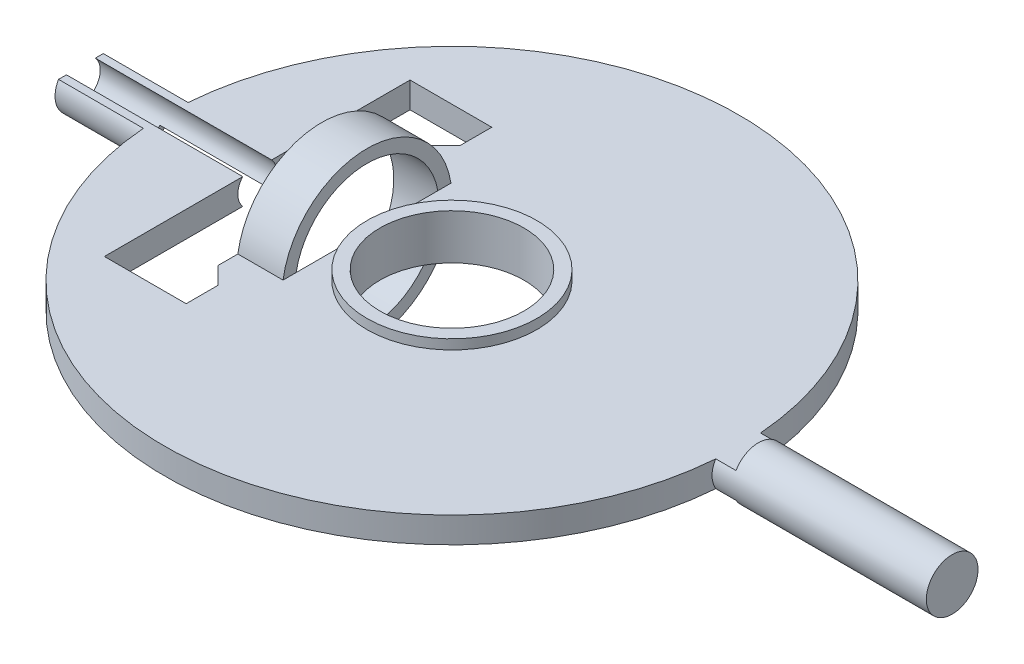
from build123d import *

# Parameters (mm, degrees)
SKETCH1_R                    = 44.45
BOSS_EXTRUDE1_DEPTH          = 2
SKETCH5_R                    = 13.15
SKETCH5_R_2                  = 11.15
BOSS_EXTRUDE2_DEPTH          = 3.5
CUT_EXTRUDE2_DEPTH           = 63.959153425
CUT_EXTRUDE2_DEPTH_BACK      = 63.959153425
SKETCH5_2_R                  = 11.15
BOSS_EXTRUDE4_DEPTH          = 2
CUT_EXTRUDE_THIN1_REACH      = 106.853
CUT_EXTRUDE_THIN1_END_RADIUS = 44.45
SKETCH7_R                    = 8
SKETCH7_R_2                  = 4
BOSS_EXTRUDE6_START          = 30
SKETCH7_3_R                  = 4
BOSS_EXTRUDE6_DEPTH          = 30
BOSS_EXTRUDE7_START          = 30
SKETCH11_R                   = 4
BOSS_EXTRUDE7_DEPTH          = 30
CUT_EXTRUDE3_REACH           = 163.201
CUT_EXTRUDE3_END_RADIUS      = 13.15
SKETCH13_R                   = 3
SKETCH15_R                   = 13.15
SKETCH15_R_2                 = 11.15
BOSS_EXTRUDE8_DEPTH          = 7
SKETCH15_2_R                 = 11.15
CUT_EXTRUDE4_DEPTH           = 17
CUT_EXTRUDE8_DEPTH           = 91.261993798
CUT_EXTRUDE8_DEPTH_BACK      = 91.261993798
CUT_EXTRUDE9_DEPTH           = 134.224378433
CUT_EXTRUDE10_DEPTH          = 20


with BuildPart() as part:
    # Sketch1 → Boss-Extrude1 (new, symmetric)
    with BuildSketch(Plane(origin=(0, 0, 0), x_dir=(1, 0, 0), z_dir=(0, 1, 0))):
        Circle(SKETCH1_R)
    extrude(amount=BOSS_EXTRUDE1_DEPTH, both=True)

    # Sketch5 → Boss-Extrude2 (add, symmetric)
    with BuildSketch(Plane(origin=(0, 0, 0), x_dir=(1, 0, 0), z_dir=(0, 1, 0))):
        Circle(SKETCH5_R)
        Circle(SKETCH5_R_2, mode=Mode.SUBTRACT)
    extrude(amount=BOSS_EXTRUDE2_DEPTH, both=True)

    # Sketch5<2> → Cut-Extrude2 (cut, two sides: drawn at the far end of the back side and taken through both)
    with BuildSketch(Plane(origin=(0, 0, 0), x_dir=(1, 0, 0), z_dir=(0, 1, 0)).offset(-CUT_EXTRUDE2_DEPTH_BACK)):
        Circle(SKETCH5_2_R)
    extrude(amount=CUT_EXTRUDE2_DEPTH + CUT_EXTRUDE2_DEPTH_BACK, mode=Mode.SUBTRACT)

    # Sketch6 → Boss-Extrude4 (add, symmetric)
    with BuildSketch(Plane(origin=(0, 0, 0), x_dir=(1, 0, 0), z_dir=(0, 1, 0))):
        with BuildLine():
            Line((-44.269656651, 4), (-47.45, 4))
            Line((-47.45, 4), (-47.45, -4))
            Line((-47.45, -4), (-44.269656651, -4))
            ThreePointArc((-44.269656651, -4), (-44.45, 0), (-44.269656651, 4))
        make_face()
        with BuildLine():
            Line((47.45, 4), (44.269656651, 4))
            ThreePointArc((44.269656651, 4), (44.45, 0), (44.269656651, -4))
            Line((44.269656651, -4), (47.45, -4))
            Line((47.45, -4), (47.45, 4))
        make_face()
    extrude(amount=BOSS_EXTRUDE4_DEPTH, both=True)

    # Cut-Extrude-Thin1: up to this cylinder (the profile starts outside it)
    cut_extrude_thin1_end = Plane(origin=(0, 0, 0), z_dir=(0, -1, 0)) * Cylinder(CUT_EXTRUDE_THIN1_END_RADIUS, 303.606, mode=Mode.PRIVATE)
    # Sketch7 → Cut-Extrude-Thin1 (cut, up to the surface)
    with BuildSketch(Plane.ZY.offset(47.45), mode=Mode.PRIVATE) as cut_extrude_thin1_sk1:
        Circle(SKETCH7_R)
        Circle(SKETCH7_R_2, mode=Mode.SUBTRACT)
    cut_extrude_thin1_tool1 = extrude(cut_extrude_thin1_sk1.sketch, amount=-CUT_EXTRUDE_THIN1_REACH, mode=Mode.PRIVATE) - cut_extrude_thin1_end
    cut_extrude_thin1 = cut_extrude_thin1_tool1.solids().sort_by_distance((-47.45, 0, -7.773726))[0]
    add(cut_extrude_thin1, mode=Mode.SUBTRACT)

    # Sketch7<3> → Boss-Extrude6 (add)
    with BuildSketch(Plane.ZY.offset(47.45).offset(BOSS_EXTRUDE6_START)):
        Circle(SKETCH7_3_R)
    extrude(amount=-BOSS_EXTRUDE6_DEPTH)

    # Mirror2: Cut-Extrude-Thin1 across plane
    add(cut_extrude_thin1.mirror(Plane(origin=(0, 0, 0), x_dir=(0, 0, 1), z_dir=(1, 0, 0))), mode=Mode.SUBTRACT)

    # Sketch11 → Boss-Extrude7 (add)
    with BuildSketch(Plane(origin=(47.45, 0, 0), x_dir=(0, 0, -1), z_dir=(1, 0, 0)).offset(BOSS_EXTRUDE7_START)):
        Circle(SKETCH11_R)
    extrude(amount=-BOSS_EXTRUDE7_DEPTH)

    # Cut-Extrude3: up to this cylinder (the profile starts outside it)
    cut_extrude3_end = Plane(origin=(0, 0, 0), z_dir=(0, -1, 0)) * Cylinder(CUT_EXTRUDE3_END_RADIUS, 353.702, mode=Mode.PRIVATE)
    # Sketch13 → Cut-Extrude3 (cut, up to the surface)
    with BuildSketch(Plane.ZY.offset(77.45), mode=Mode.PRIVATE) as cut_extrude3_sk1:
        Circle(SKETCH13_R)
    cut_extrude3_tool1 = extrude(cut_extrude3_sk1.sketch, amount=-CUT_EXTRUDE3_REACH, mode=Mode.PRIVATE) - cut_extrude3_end
    add(cut_extrude3_tool1.solids().sort_by_distance((-77.45, 0, 0))[0], mode=Mode.SUBTRACT)

    # Sketch15 → Boss-Extrude8 (add)
    with BuildSketch(Plane.ZY.offset(13.15)):
        Circle(SKETCH15_R)
        Circle(SKETCH15_R_2, mode=Mode.SUBTRACT)
    extrude(amount=BOSS_EXTRUDE8_DEPTH)

    # Sketch15<2> → Cut-Extrude4 (cut)
    with BuildSketch(Plane.ZY.offset(13.15)):
        Circle(SKETCH15_2_R)
    extrude(amount=CUT_EXTRUDE4_DEPTH, mode=Mode.SUBTRACT)

    # Sketch20 → Cut-Extrude8 (cut, two sides: drawn at the far end of the back side and taken through both)
    with BuildSketch(Plane(origin=(0, 0, 0), x_dir=(1, 0, 0), z_dir=(0, 1, 0)).offset(-CUT_EXTRUDE8_DEPTH_BACK)):
        Polygon((-20.15, -12.15), (-20.15, -16.050923592), (-17.489345312, -18.71157828), (-17.489345312, -23.661456888), (-30.15, -23.661456888), (-30.15, 23.661456888), (-17.489345312, 23.661456888), (-17.489345312, 18.71157828), (-20.15, 16.050923592), (-20.15, 12.15), (-20.15, 0), align=None)
    extrude(amount=CUT_EXTRUDE8_DEPTH + CUT_EXTRUDE8_DEPTH_BACK, mode=Mode.SUBTRACT)

    # Sketch23 → Cut-Extrude9 (cut, through all)
    with BuildSketch(Plane(origin=(-47.45, 0, 0), x_dir=(0, 0, -1), z_dir=(1, 0, 0))):
        with BuildLine():
            Line((-3.464101615, 2), (-2.236067977, 2))
            ThreePointArc((-2.236067977, 2), (0, 3), (2.236067977, 2))
            Line((2.236067977, 2), (3.464101615, 2))
            ThreePointArc((3.464101615, 2), (0, 4), (-3.464101615, 2))
        make_face()
    extrude(amount=-CUT_EXTRUDE9_DEPTH, mode=Mode.SUBTRACT)

    # Sketch24 → Cut-Extrude10 (cut)
    with BuildSketch(Plane.ZY.offset(77.45)):
        with BuildLine():
            Line((-2.236067977, 2), (-3.464101615, 2))
            ThreePointArc((-3.464101615, 2), (0, -4), (3.464101615, 2))
            Line((3.464101615, 2), (2.236067977, 2))
            ThreePointArc((2.236067977, 2), (0, -3), (-2.236067977, 2))
        make_face()
    extrude(amount=-CUT_EXTRUDE10_DEPTH, mode=Mode.SUBTRACT)


solid = part.part
